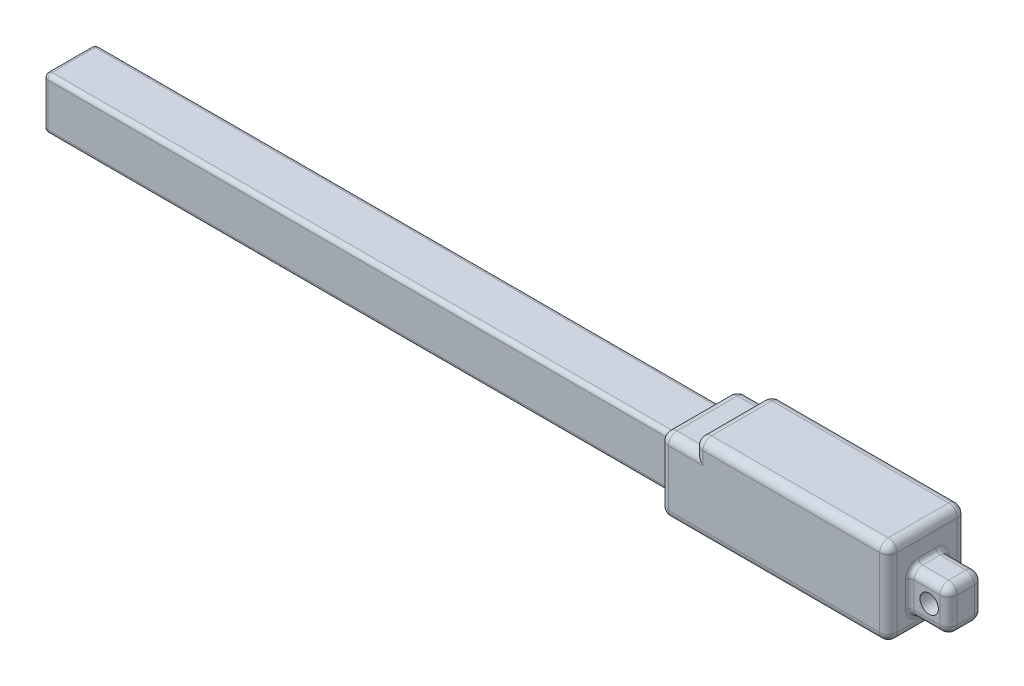
from build123d import *

# Parameters (mm, degrees)
BOSS_EXTRUDE1_DEPTH      = 9
BOSS_EXTRUDE1_DEPTH_BACK = 9
SKETCH1_W                = 53
SKETCH1_H                = 17
SKETCH2_W                = 45
SKETCH2_H                = 18
BOSS_EXTRUDE2_DEPTH      = 3
SKETCH3_W                = 8
SKETCH3_H                = 10
BOSS_EXTRUDE3_DEPTH      = 9
SKETCH4_W                = 12
SKETCH4_H                = 12
BOSS_EXTRUDE4_DEPTH      = 146
CUT_EXTRUDE1_REACH       = 149.028
SKETCH6_R                = 2.125
FILLET2_R                = 2
FILLET3_R                = 1
SKETCH7_R                = 4.5
CUT_EXTRUDE2_DEPTH       = 140
FILLET4_R                = 1


with BuildPart() as part:
    # Sketch1 → Boss-Extrude1 (new, two sides: drawn at the far end of the back side and taken through both)
    with BuildSketch(Plane.XY.offset(-BOSS_EXTRUDE1_DEPTH_BACK)):
        with Locations((26.5, 0)):
            Rectangle(SKETCH1_W, SKETCH1_H)
    extrude(amount=BOSS_EXTRUDE1_DEPTH + BOSS_EXTRUDE1_DEPTH_BACK)

    # Sketch2 → Boss-Extrude2 (add)
    with BuildSketch(Plane(origin=(0, 8.5, 0), x_dir=(1, 0, 0), z_dir=(0, 1, 0))):
        with Locations((30.5, 0)):
            Rectangle(SKETCH2_W, SKETCH2_H)
    extrude(amount=BOSS_EXTRUDE2_DEPTH)

    # Sketch3 → Boss-Extrude3 (add)
    with BuildSketch(Plane(origin=(53, 0, 0), x_dir=(0, 0, -1), z_dir=(1, 0, 0))):
        Rectangle(SKETCH3_W, SKETCH3_H)
    extrude(amount=BOSS_EXTRUDE3_DEPTH)

    # Sketch4 → Boss-Extrude4 (add)
    with BuildSketch(Plane.ZY):
        Rectangle(SKETCH4_W, SKETCH4_H)
    extrude(amount=BOSS_EXTRUDE4_DEPTH)

    # Sketch6 → Cut-Extrude1 (cut, up to next)
    with BuildSketch(Plane.XY.offset(4), mode=Mode.PRIVATE) as cut_extrude1_sk1:
        with Locations((57.5, 0)):
            Circle(SKETCH6_R)
    cut_extrude1_tool1 = extrude(cut_extrude1_sk1.sketch, amount=-CUT_EXTRUDE1_REACH, mode=Mode.PRIVATE) & part.part
    add(cut_extrude1_tool1.solids().sort_by_distance((57.5, 0, 4))[0], mode=Mode.SUBTRACT)

    # Fillet2
    fillet2_edges = [part.edges().sort_by_distance(p)[0] for p in [
        (4, 8.5, 9),
        (8, 10, 9),
        (53, 1.5, 9),
        (0, 0, 9),
        (30.5, 11.5, 9),
        (8, 11.5, 0),
        (30.5, 11.5, -9),
        (53, 11.5, 0),
        (26.5, -8.5, -9),
        (0, -8.5, 0),
        (26.5, -8.5, 9),
        (53, -8.5, 0),
        (57.5, -5, -4),
        (62, 0, -4),
        (62, -5, 0),
        (57.5, -5, 4),
        (62, 0, 4),
        (0, 8.5, 0),
        (0, 0, -9),
        (4, 8.5, -9),
        (57.5, 5, 4),
        (62, 5, 0),
        (57.5, 5, -4),
        (53, 1.5, -9),
        (8, 10, -9),
    ]]
    fillet(fillet2_edges, radius=FILLET2_R)

    # Fillet3
    fillet3_edges = [part.edges().sort_by_distance(p)[0] for p in [
        (53, -4.414213562, 3.414213562),
        (53, 0, 4),
        (53, 4.414213562, 3.414213562),
        (53, 5, 0),
        (53, 4.414213562, -3.414213562),
        (53, 0, -4),
        (53, -4.414213562, -3.414213562),
        (53, -5, 0),
    ]]
    fillet(fillet3_edges, radius=FILLET3_R)

    # Sketch7 → Cut-Extrude2 (cut)
    with BuildSketch(Plane.ZY.offset(146)):
        Circle(SKETCH7_R)
    extrude(amount=-CUT_EXTRUDE2_DEPTH, mode=Mode.SUBTRACT)

    # Fillet4
    fillet4_edges = [part.edges().sort_by_distance(p)[0] for p in [
        (-146, 0, -6),
        (-146, -6, 0),
        (-73, -6, 6),
        (-73, -6, -6),
        (-146, 6, 0),
        (-73, 6, -6),
        (-146, 0, 6),
        (-73, 6, 6),
    ]]
    fillet(fillet4_edges, radius=FILLET4_R)


solid = part.part
